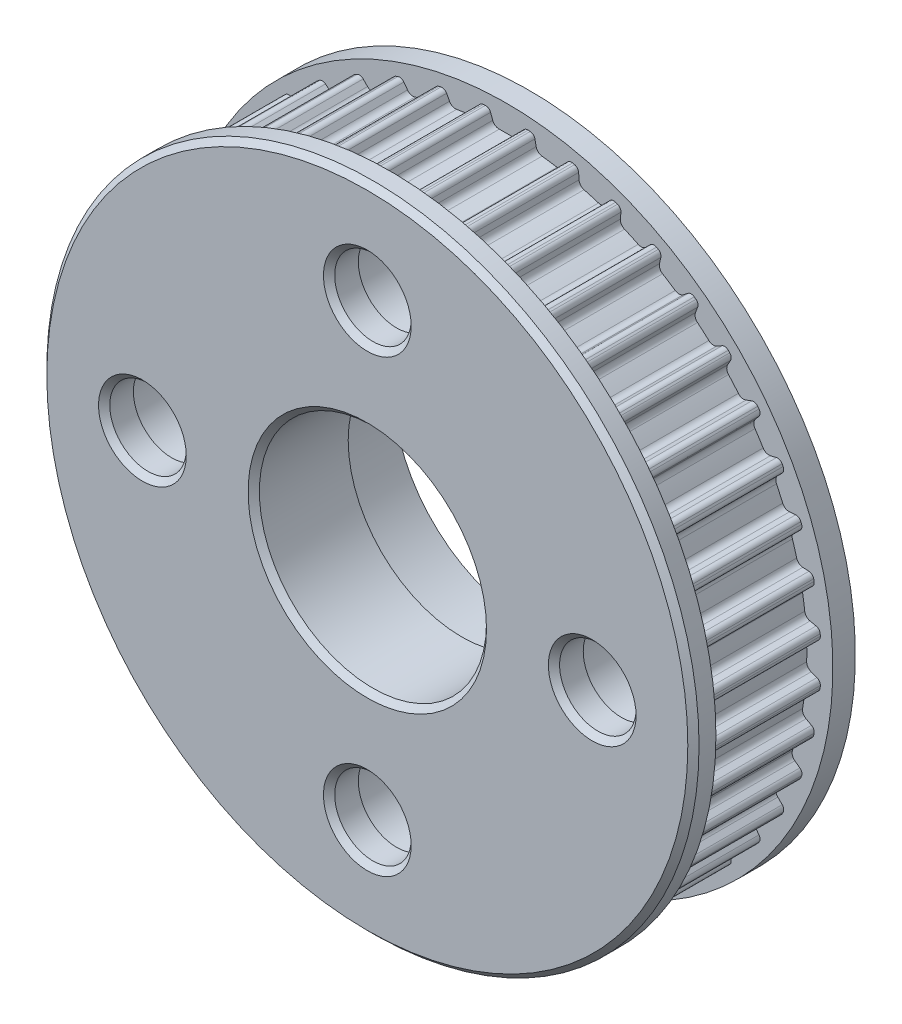
from build123d import *

# Parameters (mm, degrees)
EXTRUDE_1_DEPTH          = 5.2
PATTERN_CIRCULAR_1_COUNT = 44
SKETCH_2_R               = 14.5
EXTRUDE_2_DEPTH          = 1
EXTRUDE_START            = 1
SKETCH_3_R               = 14.5
EXTRUDE_3_DEPTH          = 1
SKETCH_4_R               = 1.7
SKETCH_4_R_2             = 5.05
CUT_EXTRUDE_1_DEPTH      = 22.733384458
SKETCH_5_R               = 6.05
CUT_EXTRUDE_2_DEPTH      = 3
SKETCH_6_R               = 2.01
CUT_EXTRUDE_3_DEPTH      = 5.9
CHAMFER_1_SIZE           = 0.25


with BuildPart() as part:
    # ｽｹｯﾁ1 → ﾎﾞｽ - 押し出し1 (new body)
    with BuildSketch(Plane.XY):
        with BuildLine():
            Line((-0.718619178, 13.791843341), (-0.624441519, 13.533092349))
            ThreePointArc((-0.624441519, 13.533092349), (-0.511507217, 13.387811398), (-0.335, 13.335793002))
            ThreePointArc((-0.335, 13.335793002), (0, 13.34), (0.335, 13.335793002))
            ThreePointArc((0.335, 13.335793002), (0.511507217, 13.387811398), (0.624441519, 13.533092349))
            Line((0.624441519, 13.533092349), (0.718619178, 13.791843341))
            ThreePointArc((0.718619178, 13.791843341), (0.809312364, 13.905962993), (0.950389962, 13.942646231))
            ThreePointArc((0.950389962, 13.942646231), (0.973678882, 13.941039216), (0.996965085, 13.939393302))
            Line((0.996965085, 13.939393302), (0.713391832, 9.974521146))
            ThreePointArc((0.713391832, 9.974521146), (0, -10), (-0.713391832, 9.974521146))
            Line((-0.713391832, 9.974521146), (-0.996965085, 13.939393302))
            ThreePointArc((-0.996965085, 13.939393302), (-0.973678882, 13.941039216), (-0.950389962, 13.942646231))
            ThreePointArc((-0.950389962, 13.942646231), (-0.809312364, 13.905962993), (-0.718619178, 13.791843341))
        make_face()
    extrude_1 = extrude(amount=EXTRUDE_1_DEPTH)

    # 円形ﾊﾟﾀｰﾝ1: ﾎﾞｽ - 押し出し1 ×44 about axis
    pattern_circular_1_axis = Axis((0, 0, 5.2), (0, 0, -1))
    for i in range(1, PATTERN_CIRCULAR_1_COUNT):
        add(extrude_1.rotate(pattern_circular_1_axis, i * 360 / PATTERN_CIRCULAR_1_COUNT))

    # ｽｹｯﾁ2 → ﾎﾞｽ - 押し出し2 (add)
    with BuildSketch(Plane(origin=(0, 0, 0), x_dir=(-1, 0, 0), z_dir=(0, 0, -1))):
        Circle(SKETCH_2_R)
    extrude(amount=EXTRUDE_2_DEPTH)

    # ｽｹｯﾁ3 → ﾎﾞｽ - 押し出し3 (add)
    with BuildSketch(Plane.XY.offset(5.2).offset(EXTRUDE_START)):
        Circle(SKETCH_3_R)
    extrude(amount=-EXTRUDE_3_DEPTH)

    # ｽｹｯﾁ4 → ｶｯﾄ - 押し出し1 (cut, through all)
    with BuildSketch(Plane.XY.offset(6.2)):
        with Locations((0, 10)):
            Circle(SKETCH_4_R)
        with Locations((10, 0)):
            Circle(SKETCH_4_R)
        with Locations((0, -10)):
            Circle(SKETCH_4_R)
        with Locations((-10, 0)):
            Circle(SKETCH_4_R)
        Circle(SKETCH_4_R_2)
    extrude(amount=-CUT_EXTRUDE_1_DEPTH, mode=Mode.SUBTRACT)

    # ｽｹｯﾁ5 → ｶｯﾄ - 押し出し2 (cut)
    with BuildSketch(Plane(origin=(0, 0, -1), x_dir=(-1, 0, 0), z_dir=(0, 0, -1))):
        Circle(SKETCH_5_R)
    extrude(amount=-CUT_EXTRUDE_2_DEPTH, mode=Mode.SUBTRACT)

    # ｽｹｯﾁ6 → ｶｯﾄ - 押し出し3 (cut)
    with BuildSketch(Plane(origin=(0, 0, -1), x_dir=(-1, 0, 0), z_dir=(0, 0, -1))):
        with Locations((0, 10)):
            Circle(SKETCH_6_R)
        with Locations((10, 0)):
            Circle(SKETCH_6_R)
        with Locations((0, -10)):
            Circle(SKETCH_6_R)
        with Locations((-10, 0)):
            Circle(SKETCH_6_R)
    extrude(amount=-CUT_EXTRUDE_3_DEPTH, mode=Mode.SUBTRACT)

    # 面取り1
    chamfer_1_edges = [part.edges().sort_by_distance(p)[0] for p in [
        (-14.5, 0, 6.2),
        (-5.05, 0, 6.2),
        (8.3, 0, 6.2),
        (-1.7, -10, 6.2),
        (-11.7, 0, 6.2),
        (-1.7, 10, 6.2),
    ]]
    chamfer(chamfer_1_edges, length=CHAMFER_1_SIZE)


solid = part.part
